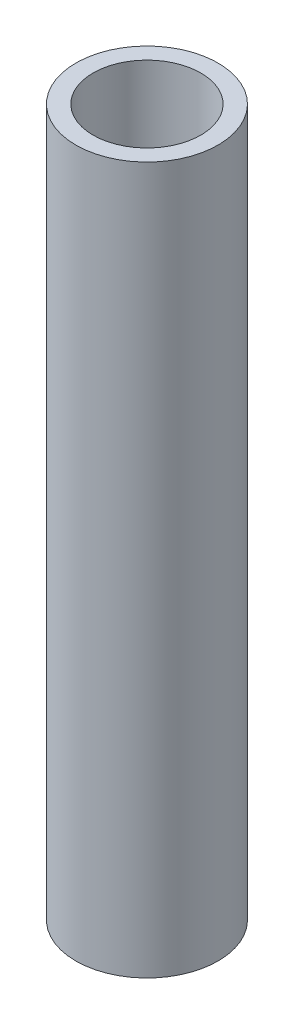
from build123d import *

# Parameters (mm, degrees)
SKETCH1_R           = 0.825
SKETCH1_R_2         = 0.625
BOSS_EXTRUDE1_DEPTH = 8.2


with BuildPart() as part:
    # Sketch1 → Boss-Extrude1 (new body)
    with BuildSketch(Plane(origin=(0, 0, 0), x_dir=(1, 0, 0), z_dir=(0, 1, 0))):
        Circle(SKETCH1_R)
        Circle(SKETCH1_R_2, mode=Mode.SUBTRACT)
    extrude(amount=BOSS_EXTRUDE1_DEPTH)


solid = part.part
